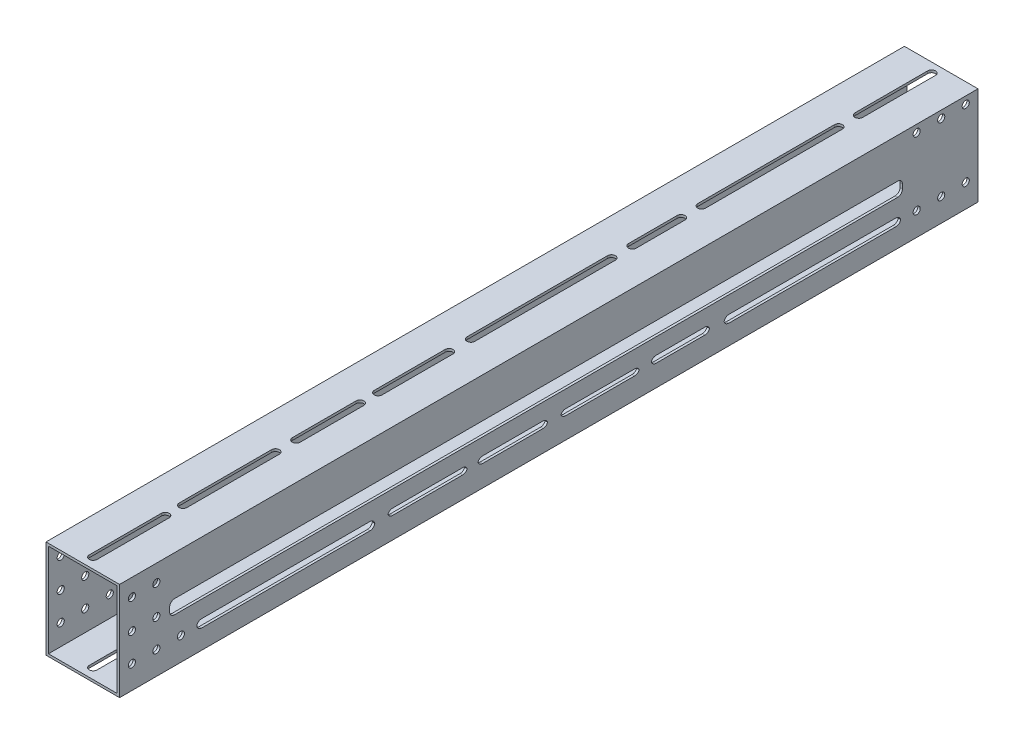
from build123d import *

# Parameters (mm, degrees)
SKETCH_4_W          = 30
SKETCH_4_H          = 40
SKETCH_4_W_2        = 28
SKETCH_4_H_2        = 38
EXTRUDE_1_DEPTH     = 350
SKETCH_6_R          = 1.45
CUT_EXTRUDE_1_DEPTH = 28.5
SKETCH_11_R         = 1.45
CUT_EXTRUDE_2_DEPTH = 352.852241715
SKETCH_13_W         = 298.803519339
SKETCH_13_H         = 5.691561969
SKETCH_13_W_2       = 72.66634008
SKETCH_13_H_2       = 3.289903706
SKETCH_13_W_3       = 32.549167975
SKETCH_13_H_3       = 2.559519455
SKETCH_13_W_4       = 28.633374463
SKETCH_13_H_4       = 2.676811881
SKETCH_13_W_5       = 32.180584642
SKETCH_13_H_5       = 2.465889143
SKETCH_13_W_6       = 23.916584823
SKETCH_13_H_6       = 2.786677623
SKETCH_13_W_7       = 72.119908252
SKETCH_13_H_7       = 3.086718329
CUT_EXTRUDE_3_DEPTH = 352.852241715
CUT_EXTRUDE_4_DEPTH = 353.597504245
FILLET_1_R          = 2


with BuildPart() as part:
    # 草图4 → 凸台-拉伸1 (new body)
    with BuildSketch(Plane.XY):
        Rectangle(SKETCH_4_W, SKETCH_4_H)
        Rectangle(SKETCH_4_W_2, SKETCH_4_H_2, mode=Mode.SUBTRACT)
    extrude(amount=EXTRUDE_1_DEPTH)

    # 草图6 → 切除-拉伸1 (cut, symmetric)
    with BuildSketch(Plane(origin=(0, 0, 0), x_dir=(0, 0, -1), z_dir=(1, 0, 0))):
        with Locations((-5, -10.5)):
            Circle(SKETCH_6_R)
        with Locations((-15, -10.5)):
            Circle(SKETCH_6_R)
        with Locations((-25, -10.5)):
            Circle(SKETCH_6_R)
        with Locations((-345, -10.5)):
            Circle(SKETCH_6_R)
        with Locations((-335, -10.5)):
            Circle(SKETCH_6_R)
        with Locations((-325, -10.5)):
            Circle(SKETCH_6_R)
        with Locations((-345, 13)):
            Circle(SKETCH_6_R)
        with Locations((-335, 13)):
            Circle(SKETCH_6_R)
        with Locations((-345, 1)):
            Circle(SKETCH_6_R)
        with Locations((-335, 1)):
            Circle(SKETCH_6_R)
    extrude(amount=CUT_EXTRUDE_1_DEPTH, both=True, mode=Mode.SUBTRACT)

    # 草图11 → 切除-拉伸2 (cut, through all)
    with BuildSketch(Plane.ZY.offset(15)):
        with Locations((5, 17)):
            Circle(SKETCH_11_R)
        with Locations((15, 17)):
            Circle(SKETCH_11_R)
        with Locations((25, 17)):
            Circle(SKETCH_11_R)
    extrude(amount=-CUT_EXTRUDE_2_DEPTH, mode=Mode.SUBTRACT)

    # 草图13 → 切除-拉伸3 (cut, through all)
    with BuildSketch(Plane(origin=(15, 0, 0), x_dir=(0, 0, -1), z_dir=(1, 0, 0))):
        with Locations((-180.186883047, 0.916719167)):
            Rectangle(SKETCH_13_W, SKETCH_13_H)
        with Locations((-282.239761455, -10.475117152)):
            Rectangle(SKETCH_13_W_2, SKETCH_13_H_2)
        with Locations((-224.420414057, -10.007199396)):
            Rectangle(SKETCH_13_W_3, SKETCH_13_H_3)
        with Locations((-189.685636116, -9.957725242)):
            Rectangle(SKETCH_13_W_4, SKETCH_13_H_4)
        with Locations((-154.078274435, -10.137081812)):
            Rectangle(SKETCH_13_W_5, SKETCH_13_H_5)
        with Locations((-121.325755168, -9.871377901)):
            Rectangle(SKETCH_13_W_6, SKETCH_13_H_6)
        with Locations((-67.521444072, -10.410462894)):
            Rectangle(SKETCH_13_W_7, SKETCH_13_H_7)
    extrude(amount=-CUT_EXTRUDE_3_DEPTH, mode=Mode.SUBTRACT)

    # 草图14 → 切除-拉伸4 (cut, through all)
    with BuildSketch(Plane(origin=(0, 20, 0), x_dir=(1, 0, 0), z_dir=(0, 1, 0))):
        with BuildLine():
            Line((1.6, -3.905552262), (1.6, -33.582203099))
            ThreePointArc((1.6, -33.582203099), (0, -35.182203099), (-1.6, -33.582203099))
            Line((-1.6, -33.582203099), (-1.6, -3.905552262))
            ThreePointArc((-1.6, -3.905552262), (0, -2.305552262), (1.6, -3.905552262))
        make_face()
        with BuildLine():
            Line((1.6, -41.873883648), (1.6, -97.67811724))
            ThreePointArc((1.6, -97.67811724), (0, -99.27811724), (-1.6, -97.67811724))
            Line((-1.6, -97.67811724), (-1.6, -41.873883648))
            ThreePointArc((-1.6, -41.873883648), (0, -40.273883648), (1.6, -41.873883648))
        make_face()
        with BuildLine():
            Line((1.6, -106.064363803), (1.6, -125.947929373))
            ThreePointArc((1.6, -125.947929373), (0, -127.547929373), (-1.6, -125.947929373))
            Line((-1.6, -125.947929373), (-1.6, -106.064363803))
            ThreePointArc((-1.6, -106.064363803), (0, -104.464363803), (1.6, -106.064363803))
        make_face()
        with BuildLine():
            Line((1.6, -134.425002093), (1.6, -191.759469618))
            ThreePointArc((1.6, -191.759469618), (0, -193.359469618), (-1.6, -191.759469618))
            Line((-1.6, -191.759469618), (-1.6, -134.425002093))
            ThreePointArc((-1.6, -134.425002093), (0, -132.825002093), (1.6, -134.425002093))
        make_face()
        with BuildLine():
            Line((1.6, -200.645622982), (1.6, -229.586029147))
            ThreePointArc((1.6, -229.586029147), (0, -231.186029147), (-1.6, -229.586029147))
            Line((-1.6, -229.586029147), (-1.6, -200.645622982))
            ThreePointArc((-1.6, -200.645622982), (0, -199.045622982), (1.6, -200.645622982))
        make_face()
        with BuildLine():
            Line((1.6, -236.998957281), (1.6, -262.974192193))
            ThreePointArc((1.6, -262.974192193), (0, -264.574192193), (-1.6, -262.974192193))
            Line((-1.6, -262.974192193), (-1.6, -236.998957281))
            ThreePointArc((-1.6, -236.998957281), (0, -235.398957281), (1.6, -236.998957281))
        make_face()
        with BuildLine():
            Line((1.6, -271.42376909), (1.6, -309.124232262))
            ThreePointArc((1.6, -309.124232262), (0, -310.724232262), (-1.6, -309.124232262))
            Line((-1.6, -309.124232262), (-1.6, -271.42376909))
            ThreePointArc((-1.6, -271.42376909), (0, -269.82376909), (1.6, -271.42376909))
        make_face()
        with BuildLine():
            Line((1.6, -316.36846039), (1.6, -345.770922882))
            ThreePointArc((1.6, -345.770922882), (0, -347.370922882), (-1.6, -345.770922882))
            Line((-1.6, -345.770922882), (-1.6, -316.36846039))
            ThreePointArc((-1.6, -316.36846039), (0, -314.76846039), (1.6, -316.36846039))
        make_face()
    extrude(amount=-CUT_EXTRUDE_4_DEPTH, mode=Mode.SUBTRACT)

    # 圆角1
    # the kernel refuses this fillet: 2 mm, written as the material it adds along each edge
    with BuildSketch(Plane(origin=(-14, -8.867103729, 31.461489946), x_dir=(0, -1, 0), z_dir=(-1, 0, 0)), Plane(origin=(-14, -11.953822058, 31.461489946), x_dir=(0, 0, 1), z_dir=(-1, 0, 0)), Plane(origin=(-14, -11.953822058, 103.581398198), x_dir=(0, 1, 0), z_dir=(-1, 0, 0)), Plane(origin=(-14, -8.478039089, 109.367462756), x_dir=(0, -1, 0), z_dir=(-1, 0, 0)), Plane(origin=(-14, -11.264716712, 109.367462756), x_dir=(0, 0, 1), z_dir=(-1, 0, 0)), Plane(origin=(-14, -11.264716712, 133.284047579), x_dir=(0, 1, 0), z_dir=(-1, 0, 0)), Plane(origin=(-14, -8.904137241, 137.987982114), x_dir=(0, -1, 0), z_dir=(-1, 0, 0)), Plane(origin=(-14, -11.370026384, 137.987982114), x_dir=(0, 0, 1), z_dir=(-1, 0, 0)), Plane(origin=(-14, -11.370026384, 170.168566756), x_dir=(0, 1, 0), z_dir=(-1, 0, 0)), Plane(origin=(-14, -8.619319301, 175.368948884), x_dir=(0, -1, 0), z_dir=(-1, 0, 0)), Plane(origin=(-14, -11.296131182, 175.368948884), x_dir=(0, 0, 1), z_dir=(-1, 0, 0)), Plane(origin=(-14, -8.619319301, 204.002323347), x_dir=(0, 0, -1), z_dir=(-1, 0, 0)), Plane(origin=(-14, -8.727439668, 208.145830069), x_dir=(0, -1, 0), z_dir=(-1, 0, 0)), Plane(origin=(-14, -11.286959123, 208.145830069), x_dir=(0, 0, 1), z_dir=(-1, 0, 0)), Plane(origin=(-14, -11.286959123, 240.694998044), x_dir=(0, 1, 0), z_dir=(-1, 0, 0)), Plane(origin=(-14, -8.830165299, 245.906591415), x_dir=(0, -1, 0), z_dir=(-1, 0, 0)), Plane(origin=(-14, -12.120069005, 245.906591415), x_dir=(0, 0, 1), z_dir=(-1, 0, 0)), Plane(origin=(-14, -12.120069005, 318.572931495), x_dir=(0, 1, 0), z_dir=(-1, 0, 0)), Plane(origin=(-14, 3.762500151, 30.785123377), x_dir=(0, -1, 0), z_dir=(-1, 0, 0)), Plane(origin=(-14, -1.929061818, 30.785123377), x_dir=(0, 0, 1), z_dir=(-1, 0, 0)), Plane(origin=(-14, -1.929061818, 329.588642716), x_dir=(0, 1, 0), z_dir=(-1, 0, 0)), Plane(origin=(15, -8.867103729, 103.581398198), x_dir=(0, 0, -1), z_dir=(-1, 0, 0)), Plane(origin=(15, -8.478039089, 133.284047579), x_dir=(0, 0, -1), z_dir=(-1, 0, 0)), Plane(origin=(15, -8.904137241, 170.168566756), x_dir=(0, 0, -1), z_dir=(-1, 0, 0)), Plane(origin=(15, -11.296131182, 204.002323347), x_dir=(0, 1, 0), z_dir=(-1, 0, 0)), Plane(origin=(15, -8.727439668, 240.694998044), x_dir=(0, 0, -1), z_dir=(-1, 0, 0)), Plane(origin=(15, 3.762500151, 329.588642716), x_dir=(0, 0, -1), z_dir=(-1, 0, 0)), Plane(origin=(15, -8.830165299, 318.572931495), x_dir=(0, 0, -1), z_dir=(-1, 0, 0))) as fillet_1_piece_1:
        with BuildLine():
            CenterArc((FILLET_1_R, FILLET_1_R), FILLET_1_R, 180, 90)
            Line((0, FILLET_1_R), (0, 0))
            Line((0, 0), (FILLET_1_R, 0))
        make_face()
    extrude(amount=1)
    with BuildSketch(Plane(origin=(-14, -8.867103729, 103.581398198), x_dir=(0, -1, 0), z_dir=(-1, 0, 0)), Plane(origin=(-14, -8.478039089, 133.284047579), x_dir=(0, -1, 0), z_dir=(-1, 0, 0)), Plane(origin=(-14, -8.904137241, 170.168566756), x_dir=(0, -1, 0), z_dir=(-1, 0, 0)), Plane(origin=(-14, -11.296131182, 204.002323347), x_dir=(0, 0, -1), z_dir=(-1, 0, 0)), Plane(origin=(-14, -8.727439668, 240.694998044), x_dir=(0, -1, 0), z_dir=(-1, 0, 0)), Plane(origin=(-14, -8.830165299, 318.572931495), x_dir=(0, -1, 0), z_dir=(-1, 0, 0)), Plane(origin=(-14, 3.762500151, 329.588642716), x_dir=(0, -1, 0), z_dir=(-1, 0, 0)), Plane(origin=(15, -8.867103729, 31.461489946), x_dir=(0, 0, 1), z_dir=(-1, 0, 0)), Plane(origin=(15, -11.953822058, 31.461489946), x_dir=(0, 1, 0), z_dir=(-1, 0, 0)), Plane(origin=(15, -11.953822058, 103.581398198), x_dir=(0, 0, -1), z_dir=(-1, 0, 0)), Plane(origin=(15, -8.478039089, 109.367462756), x_dir=(0, 0, 1), z_dir=(-1, 0, 0)), Plane(origin=(15, -11.264716712, 109.367462756), x_dir=(0, 1, 0), z_dir=(-1, 0, 0)), Plane(origin=(15, -11.264716712, 133.284047579), x_dir=(0, 0, -1), z_dir=(-1, 0, 0)), Plane(origin=(15, -8.904137241, 137.987982114), x_dir=(0, 0, 1), z_dir=(-1, 0, 0)), Plane(origin=(15, -11.370026384, 137.987982114), x_dir=(0, 1, 0), z_dir=(-1, 0, 0)), Plane(origin=(15, -11.370026384, 170.168566756), x_dir=(0, 0, -1), z_dir=(-1, 0, 0)), Plane(origin=(15, -8.619319301, 204.002323347), x_dir=(0, -1, 0), z_dir=(-1, 0, 0)), Plane(origin=(15, -8.619319301, 175.368948884), x_dir=(0, 0, 1), z_dir=(-1, 0, 0)), Plane(origin=(15, -11.296131182, 175.368948884), x_dir=(0, 1, 0), z_dir=(-1, 0, 0)), Plane(origin=(15, -8.727439668, 208.145830069), x_dir=(0, 0, 1), z_dir=(-1, 0, 0)), Plane(origin=(15, -11.286959123, 208.145830069), x_dir=(0, 1, 0), z_dir=(-1, 0, 0)), Plane(origin=(15, -11.286959123, 240.694998044), x_dir=(0, 0, -1), z_dir=(-1, 0, 0)), Plane(origin=(15, -8.830165299, 245.906591415), x_dir=(0, 0, 1), z_dir=(-1, 0, 0)), Plane(origin=(15, -12.120069005, 245.906591415), x_dir=(0, 1, 0), z_dir=(-1, 0, 0)), Plane(origin=(15, -12.120069005, 318.572931495), x_dir=(0, 0, -1), z_dir=(-1, 0, 0)), Plane(origin=(15, 3.762500151, 30.785123377), x_dir=(0, 0, 1), z_dir=(-1, 0, 0)), Plane(origin=(15, -1.929061818, 30.785123377), x_dir=(0, 1, 0), z_dir=(-1, 0, 0)), Plane(origin=(15, -1.929061818, 329.588642716), x_dir=(0, 0, -1), z_dir=(-1, 0, 0))) as fillet_1_piece_2:
        with BuildLine():
            CenterArc((FILLET_1_R, -FILLET_1_R), FILLET_1_R, 90, 90)
            Line((0, -FILLET_1_R), (0, 0))
            Line((0, 0), (FILLET_1_R, 0))
        make_face()
    extrude(amount=1)


solid = part.part
